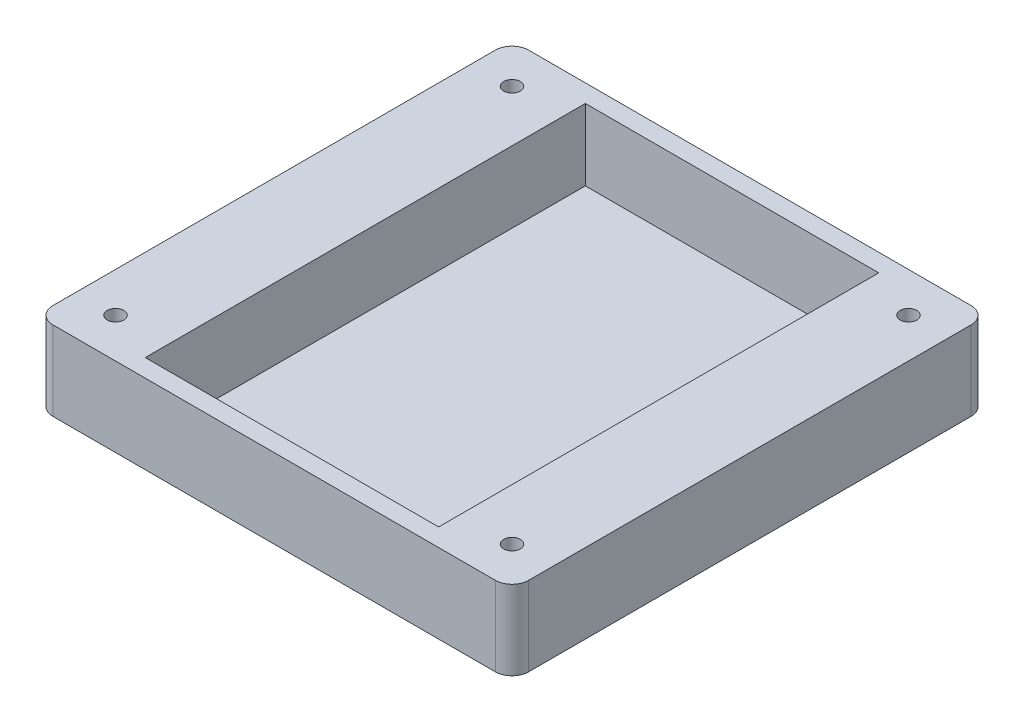
from build123d import *

# Parameters (mm, degrees)
SKETCH1_R           = 2.1
BOSS_EXTRUDE1_DEPTH = 20
SKETCH2_W           = 74
SKETCH2_H           = 111
CUT_EXTRUDE1_DEPTH  = 18


with BuildPart() as part:
    # Sketch1 → Boss-Extrude1 (new body)
    with BuildSketch(Plane(origin=(0, 0, 0), x_dir=(1, 0, 0), z_dir=(0, 1, 0))):
        with BuildLine():
            Line((-55.8, 60), (55.8, 60))
            ThreePointArc((55.8, 60), (58.769848481, 58.769848481), (60, 55.8))
            Line((60, 55.8), (60, -55.8))
            ThreePointArc((60, -55.8), (58.769848481, -58.769848481), (55.8, -60))
            Line((55.8, -60), (-55.8, -60))
            ThreePointArc((-55.8, -60), (-58.769848481, -58.769848481), (-60, -55.8))
            Line((-60, -55.8), (-60, 55.8))
            ThreePointArc((-60, 55.8), (-58.769848481, 58.769848481), (-55.8, 60))
        make_face()
        with Locations((50, 50)):
            Circle(SKETCH1_R, mode=Mode.SUBTRACT)
        with Locations((-50, 50)):
            Circle(SKETCH1_R, mode=Mode.SUBTRACT)
        with Locations((50, -50)):
            Circle(SKETCH1_R, mode=Mode.SUBTRACT)
        with Locations((-50, -50)):
            Circle(SKETCH1_R, mode=Mode.SUBTRACT)
    extrude(amount=BOSS_EXTRUDE1_DEPTH)

    # Sketch2 → Cut-Extrude1 (cut)
    with BuildSketch(Plane(origin=(0, 20, 0), x_dir=(1, 0, 0), z_dir=(0, 1, 0))):
        Rectangle(SKETCH2_W, SKETCH2_H)
    extrude(amount=-CUT_EXTRUDE1_DEPTH, mode=Mode.SUBTRACT)


solid = part.part
